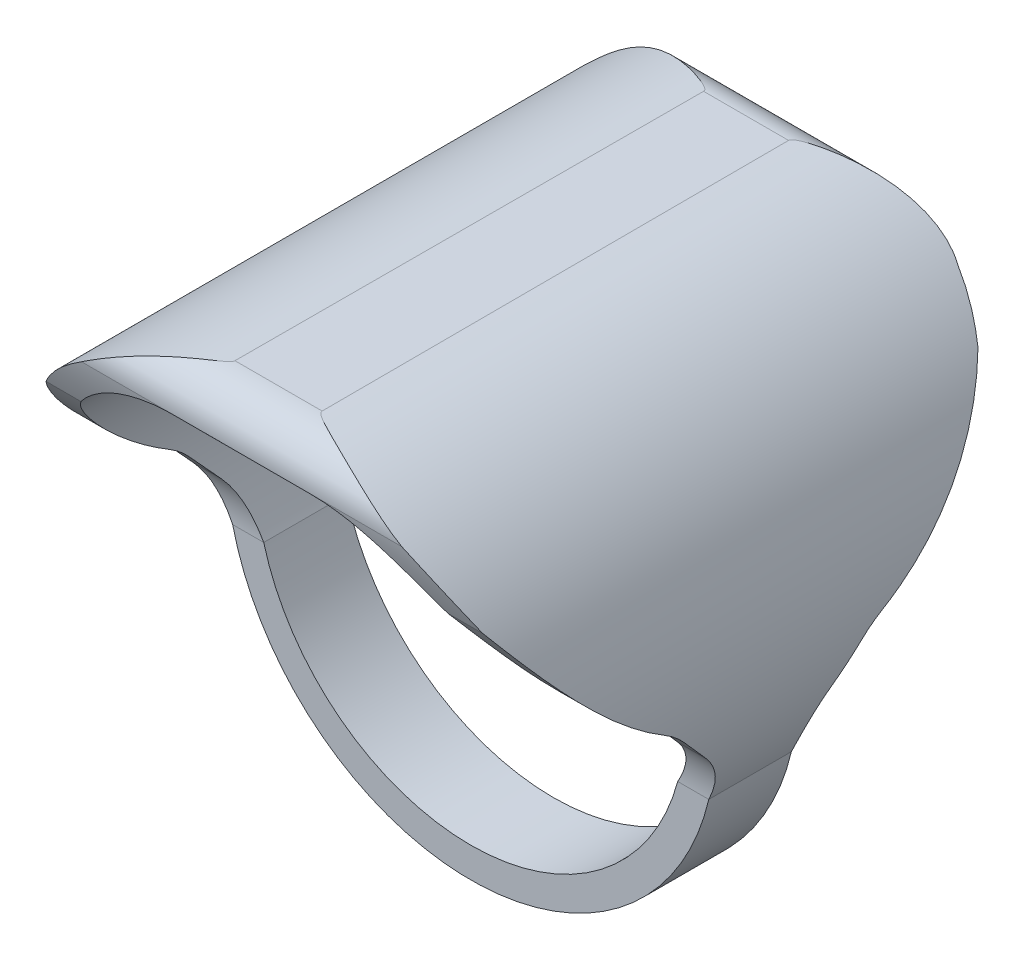
from build123d import *

# Parameters (mm, degrees)
RESSALTO_EXTRUS_O1_DEPTH  = 10
CORTE_EXTRUS_O8_OUTLINE_W = 20
CORTE_EXTRUS_O8_OUTLINE_H = 20
CORTE_EXTRUS_O8_DEPTH     = 8.5
RESSALTO_EXTRUS_O2_START  = 1
RESSALTO_EXTRUS_O2_DEPTH  = 1
VARREDURA3_START          = -1.500007282
VARREDURA3_DEPTH          = 3
CORTE_EXTRUS_O9_DEPTH     = 15.5
FILETE1_R                 = 5


# Read off the part's stored shape, not the designer's step: Corte-extrusão8, Varredura3
with BuildPart() as part:
    # Esboço1 → Ressalto-extrusão1 (new, symmetric)
    with BuildSketch(Plane.XY):
        with BuildLine():
            Line((0, 8.5), (0, 7))
            Line((0, 7), (2.692582404, 7))
            ThreePointArc((2.692582404, 7), (7.373940602, -1.369306394), (0, -7.5))
            Line((0, -7.5), (0, -8.5))
            ThreePointArc((0, -8.5), (8.5, 0), (0, 8.5))
        make_face()
    extrude(amount=RESSALTO_EXTRUS_O1_DEPTH, both=True)

    # Corte-extrusão8 outline → Corte-extrusão8 (cut)
    with BuildSketch(Plane(origin=(0, 0, 0), x_dir=(0, 0, -1), z_dir=(1, 0, 0))):
        Rectangle(CORTE_EXTRUS_O8_OUTLINE_W, CORTE_EXTRUS_O8_OUTLINE_H)
        with BuildLine():
            add(Edge.make_bspline(
                [(9.000007282, 4.914510614), (9.447062759, 5.785868524), (9.685629081, 6.469892836)],
                knots=[0, 0, 0, 0.163868034, 0.163868034, 0.163868034], degree=2))
            add(Edge.make_bspline(
                [(3.935539792, -0.04688611), (4.779617707, 0.456269007), (6.467773537, 1.786323577), (8.155929367, 3.763866822), (9.000007282, 4.914510614)],
                knots=[0.718640695, 0.718640695, 0.718640695, 0.718640695, 0.859320348, 1, 1, 1, 1], degree=3))
            ThreePointArc((3.935539792, -0.04688611), (3.567999305, -0.305127766), (3.243137148, -0.615352428))
            Line((3.243137148, -0.615352428), (2.271512773, -1.693435261))
            ThreePointArc((2.271512773, -1.693435261), (1.699517724, -2.626111152), (1.500007282, -3.701870529))
            Line((1.500007282, -3.701870529), (-1.499992718, -3.701870529))
            ThreePointArc((-1.499992718, -3.701870529), (-1.69950316, -2.626111152), (-2.271498209, -1.693435261))
            Line((-2.271498209, -1.693435261), (-3.243122584, -0.615352428))
            ThreePointArc((-3.243122584, -0.615352428), (-3.567984742, -0.305127766), (-3.935525229, -0.04688611))
            add(Edge.make_bspline(
                [(-8.999992718, 4.914510614), (-8.155914803, 3.763866822), (-6.467758973, 1.786323577), (-4.779603143, 0.456269007), (-3.935525229, -0.04688611)],
                knots=[0, 0, 0, 0, 0.140679652, 0.281359305, 0.281359305, 0.281359305, 0.281359305], degree=3))
            add(Edge.make_bspline(
                [(-8.999992718, 4.914510614), (-9.619273552, 6.143045831), (-9.827290671, 7.002933405)],
                knots=[0, 0, 0, 0.226449118, 0.226449118, 0.226449118], degree=2))
            ThreePointArc((-9.827290671, 7.002933405), (-9.482547244, 8.038405471), (-8.484479959, 8.479894004))
            Line((-8.484479959, 8.479894004), (8.506836552, 8.482513232))
            ThreePointArc((8.506836552, 8.482513232), (9.673048984, 7.814043651), (9.685629081, 6.469892836))
        make_face(mode=Mode.SUBTRACT)
    extrude(amount=CORTE_EXTRUS_O8_DEPTH, mode=Mode.SUBTRACT)

    # Esboço22 → Ressalto-extrusão2 (add)
    with BuildSketch(Plane.ZY.offset(RESSALTO_EXTRUS_O2_START)):
        with BuildLine():
            Line((-9.85199593, 7), (9.826580108, 6.999999994))
            Line((9.826580108, 6.999999994), (9.827290671, 7.002933405))
            ThreePointArc((9.827290671, 7.002933405), (9.482547244, 8.038405471), (8.484479959, 8.479894004))
            Line((8.484479959, 8.479894004), (-8.506836552, 8.48251324))
            ThreePointArc((-8.506836552, 8.48251324), (-9.507748545, 8.039169154), (-9.85199593, 7))
        make_face()
    extrude(amount=-RESSALTO_EXTRUS_O2_DEPTH)

    # Espelhar17: part across plane


with BuildPart() as part_1:
    add(part.part)
    add(part.part.mirror(Plane(origin=(-1, 0, 0), x_dir=(0, 0, 1), z_dir=(1, 0, 0))))

    # Varredura3 outline → Varredura3 (add)
    with BuildSketch(Plane.XY.offset(VARREDURA3_START)):
        with BuildLine():
            ThreePointArc((6.52274134, -3.701870529), (6.829918041, -3.098744835), (7.081469689, -2.470381964))
            Line((7.081469689, -2.470381964), (6.760891253, -2.353494698))
            ThreePointArc((6.760891253, -2.353494698), (6.671498267, -3.032925038), (6.52274134, -3.701870529))
        make_face()
        with BuildLine():
            Line((7.651545895, -3.701870529), (6.52274134, -3.701870529))
            ThreePointArc((6.52274134, -3.701870529), (-1, -9.46822023), (-8.52274134, -3.701870529))
            Line((-8.52274134, -3.701870529), (-9.651545895, -3.701870529))
            ThreePointArc((-9.651545895, -3.701870529), (-1, -10.563106097), (7.651545895, -3.701870529))
        make_face()
    extrude(amount=VARREDURA3_DEPTH)

    # Esboço24 → Corte-extrusão9 (cut, symmetric)
    with BuildSketch(Plane.XY):
        with BuildLine():
            Line((-4.692582404, 7), (2.692582404, 7))
            ThreePointArc((2.692582404, 7), (4.307155609, 6.139903139), (5.665473098, 4.914510614))
            ThreePointArc((5.665473098, 4.914510614), (7.034580308, 2.600899823), (7.499853445, -0.04688611))
            ThreePointArc((7.499853445, -0.04688611), (7.492676559, -0.331357775), (7.474713465, -0.615352428))
            ThreePointArc((7.474713465, -0.615352428), (7.410147472, -1.157460341), (7.30631761, -1.693435261))
            ThreePointArc((7.30631761, -1.693435261), (6.987071698, -2.725954711), (6.52274134, -3.701870529))
            ThreePointArc((6.52274134, -3.701870529), (-1, -9.46822023), (-8.52274134, -3.701870529))
            ThreePointArc((-8.52274134, -3.701870529), (-8.987071698, -2.725954711), (-9.30631761, -1.693435261))
            ThreePointArc((-9.30631761, -1.693435261), (-9.410147472, -1.157460341), (-9.474713465, -0.615352428))
            ThreePointArc((-9.474713465, -0.615352428), (-9.492676559, -0.331357775), (-9.499853445, -0.04688611))
            ThreePointArc((-9.499853445, -0.04688611), (-9.034580308, 2.600899823), (-7.665473098, 4.914510614))
            ThreePointArc((-7.665473098, 4.914510614), (-6.307155609, 6.139903139), (-4.692582404, 7))
        make_face()
    extrude(amount=CORTE_EXTRUS_O9_DEPTH, both=True, mode=Mode.SUBTRACT)

    # Filete1
    filete1_edges = [part_1.edges().sort_by_distance(p)[0] for p in [
        (-4.692582404, 7, -0.01270694),
        (2.692582404, 7, -0.01270694),
    ]]
    fillet(filete1_edges, radius=FILETE1_R)


solid = part_1.part
